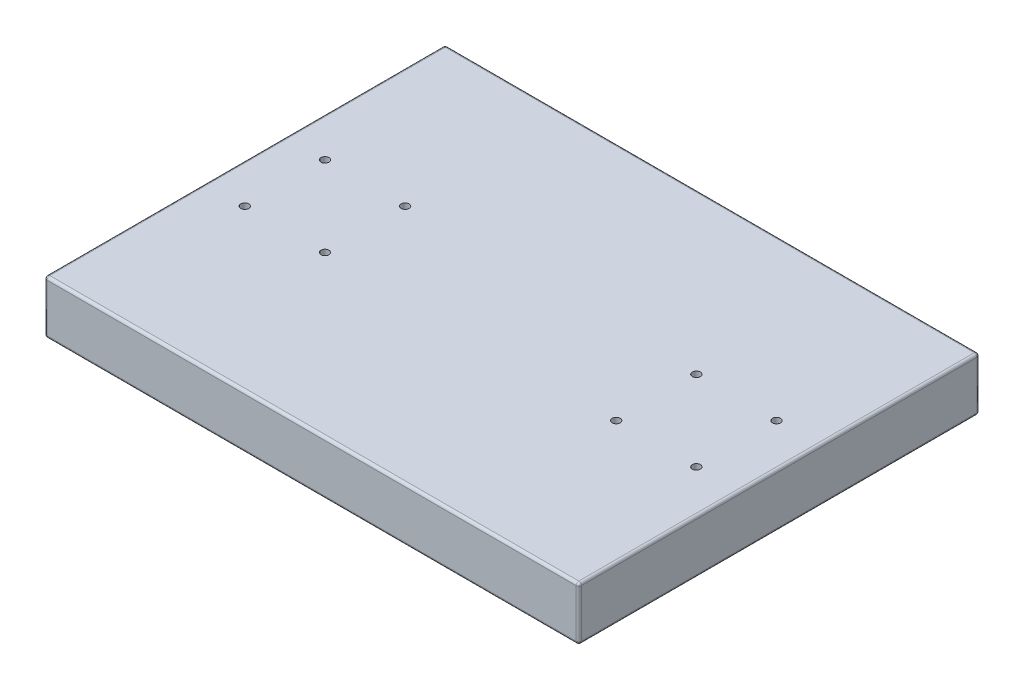
from build123d import *

# Parameters (mm, degrees)
SKETCH2_W           = 200
SKETCH2_H           = 150
BOSS_EXTRUDE1_DEPTH = 20
FILLET1_R           = 1
FILLET2_R           = 1
SKETCH3_R           = 1.5
CUT_EXTRUDE1_DEPTH  = 20
SKETCH4_R           = 1.5
CUT_EXTRUDE2_DEPTH  = 20


with BuildPart() as part:
    # Sketch2 → Boss-Extrude1 (new body)
    with BuildSketch(Plane(origin=(0, 0, 0), x_dir=(1, 0, 0), z_dir=(0, 1, 0))):
        Rectangle(SKETCH2_W, SKETCH2_H)
    extrude(amount=BOSS_EXTRUDE1_DEPTH)

    # Fillet1
    fillet1_edges = [part.edges().sort_by_distance(p)[0] for p in [
        (-100, 20, 0),
        (0, 20, 75),
        (100, 20, 0),
        (0, 0, 75),
        (-100, 0, 0),
        (0, 0, -75),
        (100, 0, 0),
        (100, 10, 75),
        (-100, 10, -75),
        (100, 10, -75),
        (0, 20, -75),
    ]]
    fillet(fillet1_edges, radius=FILLET1_R)

    # Fillet2
    # the kernel refuses this fillet: 1 mm, written as the material it takes off along each edge
    with BuildSketch(Plane(origin=(-99, 19, 74), x_dir=(-1, 0, 0), z_dir=(0, 0, 1))) as fillet2_piece_1_section:
        Polygon((0, 0), (FILLET2_R, 0), (FILLET2_R, -FILLET2_R), (0, -FILLET2_R), align=None)
    fillet2_piece_1 = extrude(amount=FILLET2_R, mode=Mode.PRIVATE)
    fillet2_piece_1 = fillet2_piece_1 - Plane(origin=(-99, 19, 74), x_dir=(0.7071067811865475, -0.7071067811865475, 0), z_dir=(0, 0, 1)) * Sphere(FILLET2_R, mode=Mode.PRIVATE)
    add(fillet2_piece_1, mode=Mode.SUBTRACT)
    with BuildSketch(Plane(origin=(-99, 1, 74), x_dir=(-1, 0, 0), z_dir=(0, 0, 1))) as fillet2_piece_2_section:
        Polygon((0, 0), (FILLET2_R, 0), (FILLET2_R, FILLET2_R), (0, FILLET2_R), align=None)
    fillet2_piece_2 = extrude(amount=FILLET2_R, mode=Mode.PRIVATE)
    fillet2_piece_2 = fillet2_piece_2 - Plane(origin=(-99, 1, 74), x_dir=(0.7071067811865475, 0.7071067811865475, 0), z_dir=(0, 0, 1)) * Sphere(FILLET2_R, mode=Mode.PRIVATE)
    add(fillet2_piece_2, mode=Mode.SUBTRACT)
    with BuildSketch(Plane(origin=(-100, 1, 75), x_dir=(1, 0, 0), z_dir=(0, 1, 0))) as fillet2_piece_3:
        with BuildLine():
            CenterArc((FILLET2_R, FILLET2_R), FILLET2_R, 180, 90)
            Line((0, FILLET2_R), (0, 0))
            Line((0, 0), (FILLET2_R, 0))
        make_face()
    extrude(amount=18, mode=Mode.SUBTRACT)

    # Sketch3 → Cut-Extrude1 (cut)
    with BuildSketch(Plane(origin=(0, 20, 0), x_dir=(1, 0, 0), z_dir=(0, 1, 0))):
        with Locations(Location((84, 15, 0), (0, 0, 270))):
            Circle(SKETCH3_R)
        with Locations(Location((54, 15, 0), (0, 0, 270))):
            Circle(SKETCH3_R)
        with Locations(Location((54, -15, 0), (0, 0, 270))):
            Circle(SKETCH3_R)
        with Locations(Location((84, -15, 0), (0, 0, 270))):
            Circle(SKETCH3_R)
    extrude(amount=-CUT_EXTRUDE1_DEPTH, mode=Mode.SUBTRACT)

    # Sketch4 → Cut-Extrude2 (cut)
    with BuildSketch(Plane(origin=(0, 20, 0), x_dir=(1, 0, 0), z_dir=(0, 1, 0))):
        with Locations(Location((-85, 15, 0), (0, 0, 270))):
            Circle(SKETCH4_R)
        with Locations(Location((-55, 15, 0), (0, 0, 270))):
            Circle(SKETCH4_R)
        with Locations(Location((-85, -15, 0), (0, 0, 270))):
            Circle(SKETCH4_R)
        with Locations(Location((-55, -15, 0), (0, 0, 270))):
            Circle(SKETCH4_R)
    extrude(amount=-CUT_EXTRUDE2_DEPTH, mode=Mode.SUBTRACT)


solid = part.part
